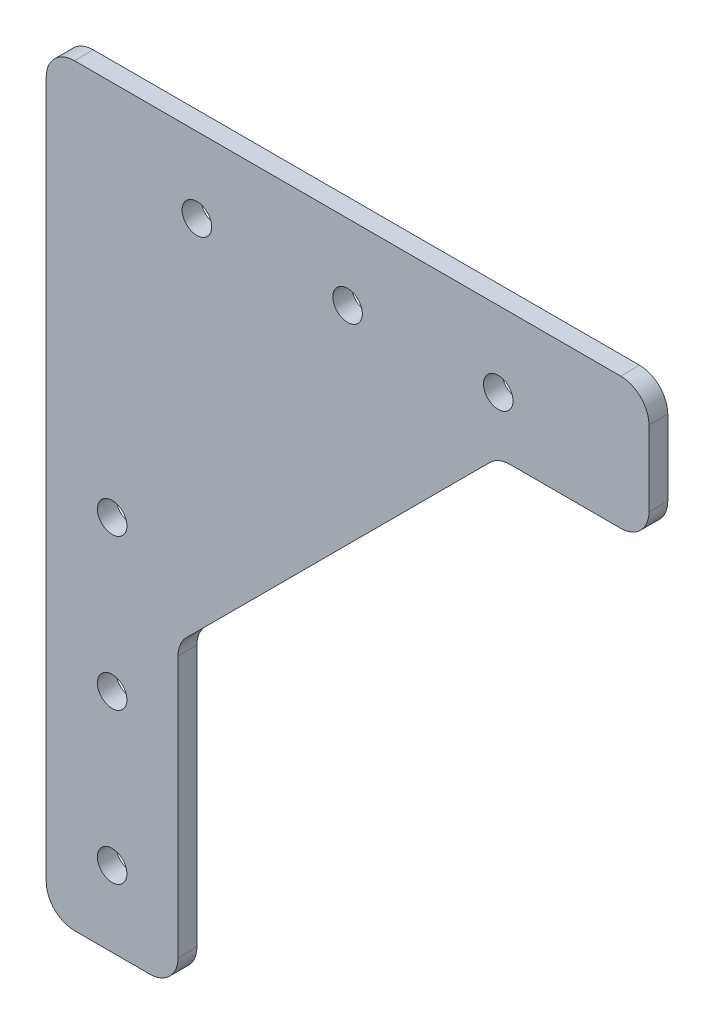
from build123d import *

# Parameters (mm, degrees)
SKETCH1_R           = 2.4892
BOSS_EXTRUDE1_DEPTH = 1.5875
FILLET1_R           = 4.7625


with BuildPart() as part:
    # Sketch1 → Boss-Extrude1 (new, symmetric)
    with BuildSketch(Plane.XY):
        Polygon((0, 127), (0, 0), (22.225, 0), (22.225, 50.8), (76.2, 104.775), (101.6, 104.775), (101.6, 127), align=None)
        with Locations((11.1125, 63.5)):
            Circle(SKETCH1_R, mode=Mode.SUBTRACT)
        with Locations((11.1125, 38.1)):
            Circle(SKETCH1_R, mode=Mode.SUBTRACT)
        with Locations((11.1125, 12.7)):
            Circle(SKETCH1_R, mode=Mode.SUBTRACT)
        with Locations((25.4, 114.3)):
            Circle(SKETCH1_R, mode=Mode.SUBTRACT)
        with Locations((50.8, 114.3)):
            Circle(SKETCH1_R, mode=Mode.SUBTRACT)
        with Locations((76.2, 114.3)):
            Circle(SKETCH1_R, mode=Mode.SUBTRACT)
    extrude(amount=BOSS_EXTRUDE1_DEPTH, both=True)

    # Fillet1
    fillet1_edges = [part.edges().sort_by_distance(p)[0] for p in [
        (0, 127, 0),
        (0, 0, 0),
        (101.6, 104.775, 0),
        (76.2, 104.775, 0),
        (22.225, 50.8, 0),
        (22.225, 0, 0),
        (101.6, 127, 0),
    ]]
    fillet(fillet1_edges, radius=FILLET1_R)


solid = part.part
